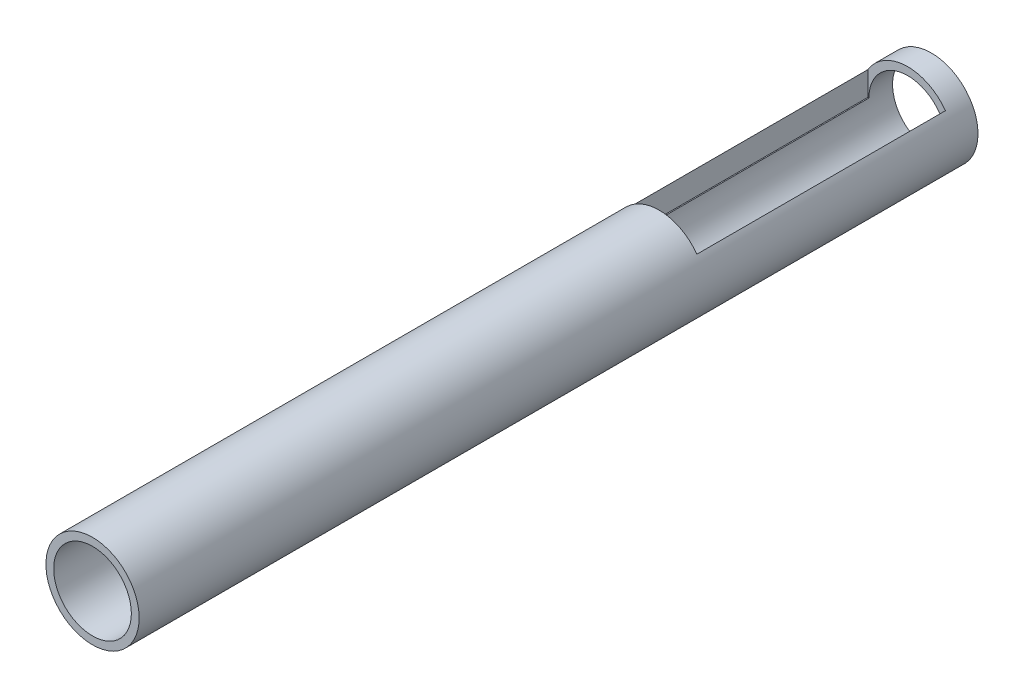
from build123d import *

# Parameters (mm, degrees)
SKETCH3_R           = 38.1
SKETCH3_R_2         = 31.75
BOSS_EXTRUDE3_DEPTH = 685.8
SKETCH4_W           = 63.5
SKETCH4_H           = 203.2
CUT_EXTRUDE2_DEPTH  = 685.8


with BuildPart() as part:
    # Sketch3 → Boss-Extrude3 (new body)
    with BuildSketch(Plane.XY):
        Circle(SKETCH3_R)
        Circle(SKETCH3_R_2, mode=Mode.SUBTRACT)
    extrude(amount=BOSS_EXTRUDE3_DEPTH)

    # Sketch4 → Cut-Extrude2 (cut)
    with BuildSketch(Plane(origin=(0, 0, 0), x_dir=(1, 0, 0), z_dir=(0, 1, 0))):
        with Locations((-0.892426947, -120.953055133)):
            Rectangle(SKETCH4_W, SKETCH4_H)
    extrude(amount=CUT_EXTRUDE2_DEPTH, mode=Mode.SUBTRACT)


solid = part.part
